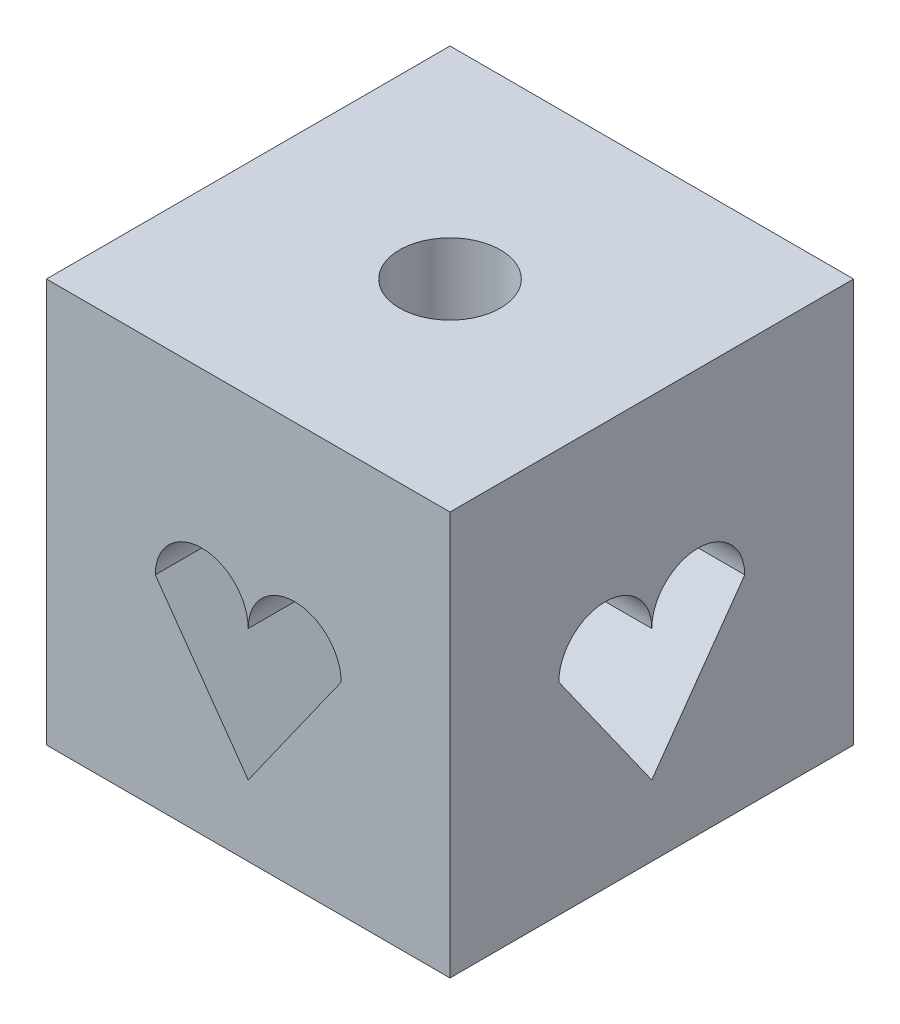
from build123d import *
from build123d.topology import SkipClean

# Parameters (mm, degrees)
SKETCH1_W           = 100
SKETCH1_H           = 100
BOSS_EXTRUDE1_DEPTH = 100
CUT_EXTRUDE1_DEPTH  = 50
CIRPATTERN1_START   = -50
CIRPATTERN1_DEPTH   = 100
CIRPATTERN1_2_DEPTH = 50
SKETCH3_R           = 12.5
CUT_EXTRUDE2_DEPTH  = 22


with BuildPart() as part:
    # Sketch1 → Boss-Extrude1 (new body)
    with BuildSketch(Plane(origin=(0, 0, 0), x_dir=(1, 0, 0), z_dir=(0, 1, 0))):
        Rectangle(SKETCH1_W, SKETCH1_H)
    extrude(amount=BOSS_EXTRUDE1_DEPTH)

    # Sketch2 → Cut-Extrude1 (cut)
    with BuildSketch(Plane.ZY.offset(50)):
        with BuildLine():
            Line((0, 17.495781671), (-23.033292242, 50))
            ThreePointArc((-23.033292242, 50), (-11.516646121, 61.516646121), (0, 50))
            ThreePointArc((0, 50), (11.516646121, 61.516646121), (23.033292242, 50))
            Line((23.033292242, 50), (0, 17.495781671))
        make_face()
    extrude(amount=-CUT_EXTRUDE1_DEPTH, mode=Mode.SUBTRACT)

    # CirPattern1: read off the stored shape, not the designer's step
    # CirPattern1 outline → CirPattern1 (cut)
    with SkipClean():  # the faces are left unmerged after this step: merging them gives an invalid solid
        with BuildSketch(Plane.XY.offset(CIRPATTERN1_START)):
            with BuildLine():
                Line((-23.033292242, 50), (0, 17.495781671))
                Line((0, 17.495781671), (23.033292242, 50))
                ThreePointArc((23.033292242, 50), (11.516646121, 61.516646121), (0, 50))
                ThreePointArc((0, 50), (-11.516646121, 61.516646121), (-23.033292242, 50))
            make_face()
        extrude(amount=CIRPATTERN1_DEPTH, mode=Mode.SUBTRACT)

    # CirPattern1 2 outline → CirPattern1 2 (cut)
    with SkipClean():  # the faces are left unmerged after this step: merging them gives an invalid solid
        with BuildSketch(Plane.YZ):
            with BuildLine():
                Line((17.495781671, 0), (50, -23.033292242))
                ThreePointArc((50, -23.033292242), (61.516646121, -11.516646121), (50, 0))
                ThreePointArc((50, 0), (61.516646121, 11.516646121), (50, 23.033292242))
                Line((50, 23.033292242), (17.495781671, 0))
            make_face()
        extrude(amount=CIRPATTERN1_2_DEPTH, mode=Mode.SUBTRACT)

    # Sketch3 → Cut-Extrude2 (cut)
    with SkipClean():  # the faces are left unmerged after this step: merging them gives an invalid solid
        with BuildSketch(Plane(origin=(0, 100, 0), x_dir=(1, 0, 0), z_dir=(0, 1, 0))):
            with Locations(Location((0, 0, 0), (0, 0, 270))):
                Circle(SKETCH3_R)
        extrude(amount=-CUT_EXTRUDE2_DEPTH, mode=Mode.SUBTRACT)


solid = part.part
